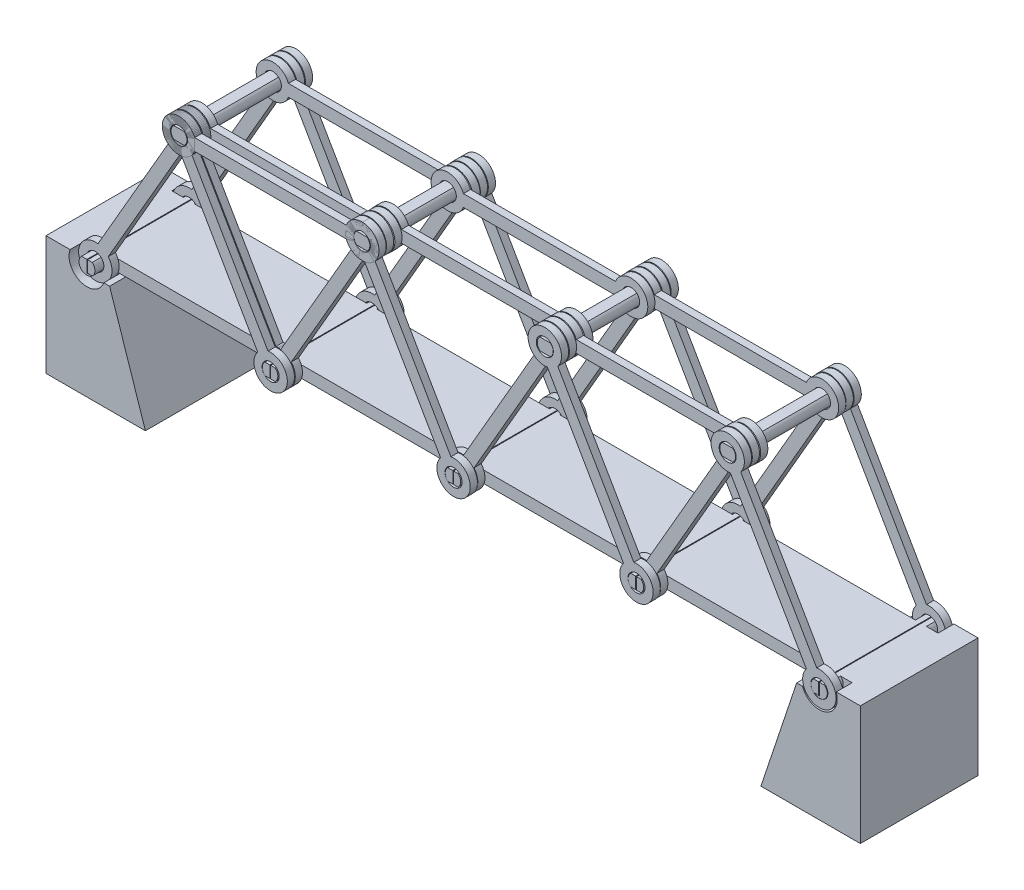
from build123d import *

# Parameters (mm, degrees)
BOSS_EXTRUDE1_DEPTH   = 14.8
BOSS_EXTRUDE1_2_DEPTH = 14.8
SKETCH2_W             = 184.2
SKETCH2_H             = 3
CUT_EXTRUDE1_DEPTH    = 210.091367588
SKETCH3_W             = 45.8
SKETCH3_H             = 2.95
BOSS_EXTRUDE2_DEPTH   = 10.8
BOSS_EXTRUDE3_START   = -14.8
BOSS_EXTRUDE3_DEPTH   = 29.6
SKETCH6_R             = 4.5
SKETCH6_R_2           = 2
CUT_EXTRUDE2_DEPTH    = 4
LPATTERN1_COUNT       = 4
LPATTERN1_PITCH       = 46
BOSS_EXTRUDE4_START   = 0.1
SKETCH7_R             = 2.15
BOSS_EXTRUDE4_DEPTH   = 1.8
CIRPATTERN1_COUNT     = 2
CIRPATTERN1_ANGLE     = 60
LPATTERN2_COUNT       = 2
LPATTERN2_PITCH       = 2
LPATTERN3_START       = 8.9
LPATTERN3_OUTLINE_R   = 2.15
LPATTERN3_DEPTH       = 1.8
LPATTERN3_START_2     = 12.9
LPATTERN3_2_OUTLINE_R = 2.15
LPATTERN3_2_DEPTH     = 1.8
LPATTERN4_COUNT       = 4
LPATTERN4_PITCH       = 46
LPATTERN5_START       = 6.9
LPATTERN5_OUTLINE_R   = 2.15
LPATTERN5_DEPTH       = 1.8
LPATTERN5_START_2     = 8.9
LPATTERN5_2_OUTLINE_R = 2.15
LPATTERN5_2_DEPTH     = 1.8
MIRROR2_START         = -14.7
MIRROR2_OUTLINE_R     = 2.15
MIRROR2_DEPTH         = 1.8
MIRROR2_START_2       = -12.7
MIRROR2_2_OUTLINE_R   = 2.15
MIRROR2_2_DEPTH       = 1.8
MIRROR2_START_3       = -10.7
MIRROR2_3_OUTLINE_R   = 2.15
MIRROR2_3_DEPTH       = 1.8
MIRROR2_START_4       = -8.7
MIRROR2_4_OUTLINE_R   = 2.15
MIRROR2_4_DEPTH       = 1.8
BOSS_EXTRUDE5_DEPTH   = 29.4
BOSS_EXTRUDE5_2_DEPTH = 29.4
BOSS_EXTRUDE5_3_DEPTH = 29.4
BOSS_EXTRUDE5_4_DEPTH = 29.4


# Read off the part's stored shape, not the designer's step: Boss-Extrude3, LPattern3, LPattern5, Mirror2
with BuildPart() as part:
    # Sketch1 → Boss-Extrude1 (new, symmetric)
    with BuildSketch(Plane.XY):
        Polygon((0, 0), (0, 30), (15, 30), (25, 0), align=None)
    extrude(amount=BOSS_EXTRUDE1_DEPTH, both=True)


with BuildPart() as body_2:
    # Sketch1 → Boss-Extrude1 2 (new, symmetric)
    with BuildSketch(Plane.XY):
        Polygon((179.8, 0), (204.8, 0), (204.8, 30), (189.8, 30), align=None)
    extrude(amount=BOSS_EXTRUDE1_2_DEPTH, both=True)


with BuildPart() as cut_extrude1_tool:
    # Sketch2 → Cut-Extrude1 (new, through all)
    with BuildSketch(Plane.XY.offset(14.8)):
        with Locations((102.4, 28.5)):
            Rectangle(SKETCH2_W, SKETCH2_H)
    extrude(amount=-CUT_EXTRUDE1_DEPTH)


with BuildPart() as part_1:
    add(part.part)

    # Cut-Extrude1: cut by cut_extrude1_tool
    add(cut_extrude1_tool.part, mode=Mode.SUBTRACT)


with BuildPart() as body_2_1:
    add(body_2.part)

    # Cut-Extrude1: cut by cut_extrude1_tool
    add(cut_extrude1_tool.part, mode=Mode.SUBTRACT)


with BuildPart() as body_3:
    # Sketch3 → Boss-Extrude2 (new, symmetric)
    with BuildSketch(Plane.XY):
        with Locations((33.4, 28.525)):
            Rectangle(SKETCH3_W, SKETCH3_H)
    extrude(amount=BOSS_EXTRUDE2_DEPTH, both=True)

    # Boss-Extrude3 outline → Boss-Extrude3 (add)
    with BuildSketch(Plane.XY.offset(BOSS_EXTRUDE3_START)):
        with BuildLine():
            Line((10.5, 30), (10.5, 27.05))
            Line((10.5, 27.05), (11.650694266, 27.05))
            ThreePointArc((11.650694266, 27.05), (12.3, 28.525), (11.650694266, 30))
            Line((11.650694266, 30), (10.5, 30))
        make_face()
        with BuildLine():
            ThreePointArc((55.049305734, 30), (54.4, 28.525), (55.049305734, 27.05))
            Line((55.049305734, 27.05), (56.3, 27.05))
            Line((56.3, 27.05), (56.3, 30))
            Line((56.3, 30), (55.049305734, 30))
        make_face()
    extrude(amount=BOSS_EXTRUDE3_DEPTH)


with BuildPart() as cut_extrude2_tool:
    # Sketch6 → Cut-Extrude2 (new body)
    # profile 1 of 2: a face of its own
    with BuildSketch(Plane.XY.offset(14.8)):
        with Locations((10.3, 28.525)):
            Circle(SKETCH6_R)
        with Locations((10.3, 28.525)):
            Circle(SKETCH6_R_2, mode=Mode.SUBTRACT)
    # profile 2 of 2: a face of its own
    with BuildSketch(Plane.XY.offset(14.8)):
        with Locations((194.5, 28.5)):
            Circle(SKETCH6_R)
        with Locations((194.5, 28.5)):
            Circle(SKETCH6_R_2, mode=Mode.SUBTRACT)
    cut_extrude2 = extrude(amount=-CUT_EXTRUDE2_DEPTH)


with BuildPart() as part_2:
    add(part_1.part)

    # Cut-Extrude2: cut by cut_extrude2_tool
    add(cut_extrude2_tool.part, mode=Mode.SUBTRACT)


with BuildPart() as body_2_2:
    add(body_2_1.part)

    # Cut-Extrude2: cut by cut_extrude2_tool
    add(cut_extrude2_tool.part, mode=Mode.SUBTRACT)


with BuildPart() as mirror1_tool:
    # Mirror1: Cut-Extrude2 across plane
    add(cut_extrude2.mirror(Plane.XY))


with BuildPart() as part_3:
    add(part_2.part)

    # Mirror1: cut by mirror1_tool
    add(mirror1_tool.part, mode=Mode.SUBTRACT)


with BuildPart() as body_2_3:
    add(body_2_2.part)

    # Mirror1: cut by mirror1_tool
    add(mirror1_tool.part, mode=Mode.SUBTRACT)


with BuildPart() as lpattern1_1:
    # LPattern1: pattern copy
    add(body_3.part.moved(Location(Vector(1, 0, 0) * (1 * LPATTERN1_PITCH))))


with BuildPart() as lpattern1_2:
    # LPattern1: pattern copy
    add(body_3.part.moved(Location(Vector(1, 0, 0) * (2 * LPATTERN1_PITCH))))


with BuildPart() as lpattern1_3:
    # LPattern1: pattern copy
    add(body_3.part.moved(Location(Vector(1, 0, 0) * (3 * LPATTERN1_PITCH))))


with BuildPart() as body_7:
    # Sketch7 → Boss-Extrude4 (new body)
    # profile 1 of 6: a face of its own
    with BuildSketch(Plane.XY.offset(10.8).offset(BOSS_EXTRUDE4_START)):
        with BuildLine():
            Line((13.56054263, 31.172425496), (13.033403127, 30.259393094))
            Line((13.033403127, 30.259393094), (10.435326916, 31.759393094))
            Line((10.435326916, 31.759393094), (10.962466419, 32.672425496))
            ThreePointArc((10.962466419, 32.672425496), (6.669394917, 26.413435004), (14.232476955, 27.05))
            Line((14.232476955, 27.05), (11.864249021, 27.05))
            ThreePointArc((11.864249021, 27.05), (8.15, 28.525), (11.864249021, 30))
            Line((11.864249021, 30), (14.232476955, 30))
            ThreePointArc((14.232476955, 30), (13.94397147, 30.613413734), (13.56054263, 31.172425496))
        make_face()
    # profile 2 of 6: a face of its own
    with BuildSketch(Plane.XY.offset(10.8).offset(BOSS_EXTRUDE4_START)):
        with BuildLine():
            Line((10.435326916, 31.759393094), (13.033403127, 30.259393094))
            Line((13.033403127, 30.259393094), (13.56054263, 31.172425496))
            ThreePointArc((13.56054263, 31.172425496), (12.4, 32.162306696), (10.962466419, 32.672425496))
            Line((10.962466419, 32.672425496), (10.435326916, 31.759393094))
        make_face()
    # profile 3 of 6: a face of its own
    with BuildSketch(Plane.XY.offset(10.8).offset(BOSS_EXTRUDE4_START)):
        with BuildLine():
            ThreePointArc((14.5, 28.525), (14.432578082, 29.274532117), (14.232476955, 30))
            Line((14.232476955, 30), (11.864249021, 30))
            ThreePointArc((11.864249021, 30), (12.298203618, 29.318525237), (12.45, 28.525))
            ThreePointArc((12.45, 28.525), (12.298203618, 27.731474763), (11.864249021, 27.05))
            Line((11.864249021, 27.05), (14.232476955, 27.05))
            ThreePointArc((14.232476955, 27.05), (14.432578082, 27.775467883), (14.5, 28.525))
        make_face()
    # profile 4 of 6: a face of its own
    with BuildSketch(Plane.XY.offset(10.8).offset(BOSS_EXTRUDE4_START)):
        with BuildLine():
            ThreePointArc((10.962466419, 32.672425496), (12.4, 32.162306696), (13.56054263, 31.172425496))
            Line((13.56054263, 31.172425496), (32.687533581, 64.301345619))
            ThreePointArc((32.687533581, 64.301345619), (31.25, 64.811464419), (30.08945737, 65.801345619))
            Line((30.08945737, 65.801345619), (10.962466419, 32.672425496))
        make_face()
    # profile 5 of 6: a face of its own
    with BuildSketch(Plane.XY.offset(10.8).offset(BOSS_EXTRUDE4_START)):
        with BuildLine():
            Line((33.214673084, 65.214378021), (32.687533581, 64.301345619))
            ThreePointArc((32.687533581, 64.301345619), (36.075586271, 65.253277494), (37.55, 68.448771114))
            ThreePointArc((37.55, 68.448771114), (31.945414482, 72.406944876), (30.08945737, 65.801345619))
            Line((30.08945737, 65.801345619), (30.616596873, 66.714378021))
            Line((30.616596873, 66.714378021), (33.214673084, 65.214378021))
        make_face()
        with Locations((33.35, 68.448771114)):
            Circle(SKETCH7_R, mode=Mode.SUBTRACT)
    # profile 6 of 6: a face of its own
    with BuildSketch(Plane.XY.offset(10.8).offset(BOSS_EXTRUDE4_START)):
        with BuildLine():
            ThreePointArc((30.08945737, 65.801345619), (31.25, 64.811464419), (32.687533581, 64.301345619))
            Line((32.687533581, 64.301345619), (33.214673084, 65.214378021))
            Line((33.214673084, 65.214378021), (30.616596873, 66.714378021))
            Line((30.616596873, 66.714378021), (30.08945737, 65.801345619))
        make_face()
    extrude(amount=BOSS_EXTRUDE4_DEPTH)


with BuildPart() as cirpattern1_1:
    # CirPattern1: pattern copy
    add(body_7.part.rotate(Axis((33.35, 68.448771114, 0), (0, 0, 1)), 1 * CIRPATTERN1_ANGLE / (CIRPATTERN1_COUNT - 1)))


with BuildPart() as lpattern2_1:
    # LPattern2: pattern copy
    add(cirpattern1_1.part.moved(Location(Vector(0, 0, 1) * (1 * LPATTERN2_PITCH))))


with BuildPart() as body_10:
    # LPattern3 outline → LPattern3 (new body)
    with BuildSketch(Plane.XY.offset(LPATTERN3_START)):
        with BuildLine():
            ThreePointArc((75.526990951, 66.948771114), (83.65, 68.448771114), (75.526990951, 69.948771114))
            Line((75.526990951, 69.948771114), (37.273009049, 69.948771114))
            ThreePointArc((37.273009049, 69.948771114), (29.15, 68.448771114), (37.273009049, 66.948771114))
            Line((37.273009049, 66.948771114), (75.526990951, 66.948771114))
        make_face()
        with Locations((33.35, 68.448771114)):
            Circle(LPATTERN3_OUTLINE_R, mode=Mode.SUBTRACT)
        with Locations((79.45, 68.448771114)):
            Circle(LPATTERN3_OUTLINE_R, mode=Mode.SUBTRACT)
    extrude(amount=LPATTERN3_DEPTH)


with BuildPart() as body_11:
    # LPattern3 2 outline → LPattern3 2 (new body)
    with BuildSketch(Plane.XY.offset(LPATTERN3_START_2)):
        with BuildLine():
            ThreePointArc((75.526990951, 66.948771114), (83.65, 68.448771114), (75.526990951, 69.948771114))
            Line((75.526990951, 69.948771114), (37.273009049, 69.948771114))
            ThreePointArc((37.273009049, 69.948771114), (29.15, 68.448771114), (37.273009049, 66.948771114))
            Line((37.273009049, 66.948771114), (75.526990951, 66.948771114))
        make_face()
        with Locations((33.35, 68.448771114)):
            Circle(LPATTERN3_2_OUTLINE_R, mode=Mode.SUBTRACT)
        with Locations((79.45, 68.448771114)):
            Circle(LPATTERN3_2_OUTLINE_R, mode=Mode.SUBTRACT)
    extrude(amount=LPATTERN3_2_DEPTH)


with BuildPart() as lpattern4_1:
    # LPattern4: pattern copy
    add(lpattern2_1.part.moved(Location(Vector(1, 0, 0) * (1 * LPATTERN4_PITCH))))


with BuildPart() as lpattern4_2:
    # LPattern4: pattern copy
    add(lpattern2_1.part.moved(Location(Vector(1, 0, 0) * (2 * LPATTERN4_PITCH))))


with BuildPart() as lpattern4_3:
    # LPattern4: pattern copy
    add(lpattern2_1.part.moved(Location(Vector(1, 0, 0) * (3 * LPATTERN4_PITCH))))


with BuildPart() as lpattern4_4:
    # LPattern4: pattern copy
    add(body_7.part.moved(Location(Vector(1, 0, 0) * (1 * LPATTERN4_PITCH))))


with BuildPart() as lpattern4_5:
    # LPattern4: pattern copy
    add(body_7.part.moved(Location(Vector(1, 0, 0) * (2 * LPATTERN4_PITCH))))


with BuildPart() as lpattern4_6:
    # LPattern4: pattern copy
    add(body_7.part.moved(Location(Vector(1, 0, 0) * (3 * LPATTERN4_PITCH))))


with BuildPart() as body_18:
    # LPattern5 outline → LPattern5 (new body)
    with BuildSketch(Plane.XY.offset(LPATTERN5_START)):
        with BuildLine():
            Line((121.526990951, 69.948771114), (83.273009049, 69.948771114))
            ThreePointArc((83.273009049, 69.948771114), (75.15, 68.448771114), (83.273009049, 66.948771114))
            Line((83.273009049, 66.948771114), (121.526990951, 66.948771114))
            ThreePointArc((121.526990951, 66.948771114), (129.65, 68.448771114), (121.526990951, 69.948771114))
        make_face()
        with Locations((125.45, 68.448771114)):
            Circle(LPATTERN5_OUTLINE_R, mode=Mode.SUBTRACT)
        with Locations((79.35, 68.448771114)):
            Circle(LPATTERN5_OUTLINE_R, mode=Mode.SUBTRACT)
    extrude(amount=LPATTERN5_DEPTH)


with BuildPart() as body_19:
    # LPattern5 2 outline → LPattern5 2 (new body)
    with BuildSketch(Plane.XY.offset(LPATTERN5_START_2)):
        with BuildLine():
            ThreePointArc((167.526990951, 66.948771114), (175.65, 68.448771114), (167.526990951, 69.948771114))
            Line((167.526990951, 69.948771114), (129.273009049, 69.948771114))
            ThreePointArc((129.273009049, 69.948771114), (121.15, 68.448771114), (129.273009049, 66.948771114))
            Line((129.273009049, 66.948771114), (167.526990951, 66.948771114))
        make_face()
        with Locations((171.45, 68.448771114)):
            Circle(LPATTERN5_2_OUTLINE_R, mode=Mode.SUBTRACT)
        with Locations((125.35, 68.448771114)):
            Circle(LPATTERN5_2_OUTLINE_R, mode=Mode.SUBTRACT)
    extrude(amount=LPATTERN5_2_DEPTH)


with BuildPart() as body_20:
    # Mirror2 outline → Mirror2 (new body)
    # profile 1 of 4: a face of its own
    with BuildSketch(Plane.XY.offset(MIRROR2_START)):
        with BuildLine():
            ThreePointArc((191.13945737, 31.172425496), (196.500000001, 24.887693304), (193.737533581, 32.672425496))
            Line((193.737533581, 32.672425496), (174.61054263, 65.801345619))
            ThreePointArc((174.61054263, 65.801345619), (169.25, 72.08607781), (172.012466419, 64.301345619))
            Line((172.012466419, 64.301345619), (191.13945737, 31.172425496))
        make_face()
        with Locations((194.4, 28.525)):
            Circle(MIRROR2_OUTLINE_R, mode=Mode.SUBTRACT)
        with Locations((171.35, 68.448771114)):
            Circle(MIRROR2_OUTLINE_R, mode=Mode.SUBTRACT)
    # profile 2 of 4: a face of its own
    with BuildSketch(Plane.XY.offset(MIRROR2_START)):
        with BuildLine():
            Line((147.737533581, 32.672425496), (128.61054263, 65.801345619))
            ThreePointArc((128.61054263, 65.801345619), (123.25, 72.08607781), (126.012466419, 64.301345619))
            Line((126.012466419, 64.301345619), (145.13945737, 31.172425496))
            ThreePointArc((145.13945737, 31.172425496), (150.500000001, 24.887693304), (147.737533581, 32.672425496))
        make_face()
        with Locations((148.4, 28.525)):
            Circle(MIRROR2_OUTLINE_R, mode=Mode.SUBTRACT)
        with Locations((125.35, 68.448771114)):
            Circle(MIRROR2_OUTLINE_R, mode=Mode.SUBTRACT)
    # profile 3 of 4: a face of its own
    with BuildSketch(Plane.XY.offset(MIRROR2_START)):
        with BuildLine():
            Line((80.012466419, 64.301345619), (99.13945737, 31.172425496))
            ThreePointArc((99.13945737, 31.172425496), (104.500000001, 24.887693304), (101.737533581, 32.672425496))
            Line((101.737533581, 32.672425496), (82.61054263, 65.801345619))
            ThreePointArc((82.61054263, 65.801345619), (77.25, 72.08607781), (80.012466419, 64.301345619))
        make_face()
        with Locations((79.35, 68.448771114)):
            Circle(MIRROR2_OUTLINE_R, mode=Mode.SUBTRACT)
        with Locations((102.4, 28.525)):
            Circle(MIRROR2_OUTLINE_R, mode=Mode.SUBTRACT)
    # profile 4 of 4: a face of its own
    with BuildSketch(Plane.XY.offset(MIRROR2_START)):
        with BuildLine():
            ThreePointArc((37.273009049, 66.948771114), (37.55, 68.448771114), (37.273009049, 69.948771114))
            ThreePointArc((37.273009049, 69.948771114), (29.712693304, 70.548771114), (34.012466419, 64.301345618))
            Line((34.012466419, 64.301345618), (53.13945737, 31.172425496))
            ThreePointArc((53.13945737, 31.172425496), (58.500000001, 24.887693304), (55.737533581, 32.672425496))
            Line((55.737533581, 32.672425496), (36.61054263, 65.801345619))
            ThreePointArc((36.61054263, 65.801345619), (36.987306696, 66.348771114), (37.273009049, 66.948771114))
        make_face()
        with Locations((33.35, 68.448771114)):
            Circle(MIRROR2_OUTLINE_R, mode=Mode.SUBTRACT)
        with Locations((56.4, 28.525)):
            Circle(MIRROR2_OUTLINE_R, mode=Mode.SUBTRACT)
    extrude(amount=MIRROR2_DEPTH)


with BuildPart() as body_21:
    # Mirror2 2 outline → Mirror2 2 (new body)
    # profile 1 of 4: a face of its own
    with BuildSketch(Plane.XY.offset(MIRROR2_START_2)):
        with BuildLine():
            ThreePointArc((172.012466419, 64.301345619), (173.45, 64.811464419), (174.61054263, 65.801345619))
            ThreePointArc((174.61054263, 65.801345619), (171.35, 72.648771114), (168.08945737, 65.801345619))
            Line((168.08945737, 65.801345619), (148.962466419, 32.672425496))
            ThreePointArc((148.962466419, 32.672425496), (146.199999999, 24.887693304), (151.56054263, 31.172425496))
            Line((151.56054263, 31.172425496), (170.687533581, 64.301345619))
            ThreePointArc((170.687533581, 64.301345619), (171.35, 64.248771115), (172.012466419, 64.301345619))
        make_face()
        with Locations((171.35, 68.448771114)):
            Circle(MIRROR2_2_OUTLINE_R, mode=Mode.SUBTRACT)
        with Locations((148.3, 28.525)):
            Circle(MIRROR2_2_OUTLINE_R, mode=Mode.SUBTRACT)
    # profile 2 of 4: a face of its own
    with BuildSketch(Plane.XY.offset(MIRROR2_START_2)):
        with BuildLine():
            Line((122.08945737, 65.801345619), (102.962466419, 32.672425496))
            ThreePointArc((102.962466419, 32.672425496), (100.199999999, 24.887693304), (105.56054263, 31.172425496))
            Line((105.56054263, 31.172425496), (124.687533581, 64.301345619))
            ThreePointArc((124.687533581, 64.301345619), (125.35, 64.248771115), (126.012466419, 64.301345619))
            ThreePointArc((126.012466419, 64.301345619), (127.45, 64.811464418), (128.61054263, 65.801345619))
            ThreePointArc((128.61054263, 65.801345619), (125.35, 72.648771114), (122.08945737, 65.801345619))
        make_face()
        with Locations((125.35, 68.448771114)):
            Circle(MIRROR2_2_OUTLINE_R, mode=Mode.SUBTRACT)
        with Locations((102.3, 28.525)):
            Circle(MIRROR2_2_OUTLINE_R, mode=Mode.SUBTRACT)
    # profile 3 of 4: a face of its own
    with BuildSketch(Plane.XY.offset(MIRROR2_START_2)):
        with BuildLine():
            Line((76.08945737, 65.801345619), (56.962466419, 32.672425496))
            ThreePointArc((56.962466419, 32.672425496), (54.199999999, 24.887693304), (59.56054263, 31.172425496))
            Line((59.56054263, 31.172425496), (78.687533581, 64.301345619))
            ThreePointArc((78.687533581, 64.301345619), (79.35, 64.248771115), (80.012466419, 64.301345619))
            ThreePointArc((80.012466419, 64.301345619), (81.45, 64.811464418), (82.61054263, 65.801345619))
            ThreePointArc((82.61054263, 65.801345619), (79.35, 72.648771114), (76.08945737, 65.801345619))
        make_face()
        with Locations((79.35, 68.448771114)):
            Circle(MIRROR2_2_OUTLINE_R, mode=Mode.SUBTRACT)
        with Locations((56.3, 28.525)):
            Circle(MIRROR2_2_OUTLINE_R, mode=Mode.SUBTRACT)
    # profile 4 of 4: a face of its own
    with BuildSketch(Plane.XY.offset(MIRROR2_START_2)):
        with BuildLine():
            ThreePointArc((37.273009049, 66.948771114), (37.55, 68.448771114), (37.273009049, 69.948771114))
            ThreePointArc((37.273009049, 69.948771114), (31.25, 72.08607781), (30.089457369, 65.801345619))
            Line((30.089457369, 65.801345619), (10.962466419, 32.672425496))
            ThreePointArc((10.962466419, 32.672425496), (8.199999999, 24.887693304), (13.56054263, 31.172425496))
            Line((13.56054263, 31.172425496), (32.687533581, 64.301345618))
            ThreePointArc((32.687533581, 64.301345618), (35.45, 64.811464418), (37.273009049, 66.948771114))
        make_face()
        with Locations((33.35, 68.448771114)):
            Circle(MIRROR2_2_OUTLINE_R, mode=Mode.SUBTRACT)
        with Locations((10.3, 28.525)):
            Circle(MIRROR2_2_OUTLINE_R, mode=Mode.SUBTRACT)
    extrude(amount=MIRROR2_2_DEPTH)


with BuildPart() as body_22:
    # Mirror2 3 outline → Mirror2 3 (new body)
    # profile 1 of 2: a face of its own
    with BuildSketch(Plane.XY.offset(MIRROR2_START_3)):
        with BuildLine():
            Line((167.526990951, 69.948771114), (129.273009049, 69.948771114))
            ThreePointArc((129.273009049, 69.948771114), (121.712693304, 70.548771114), (126.012466419, 64.301345619))
            ThreePointArc((126.012466419, 64.301345619), (127.45, 64.811464418), (128.61054263, 65.801345619))
            ThreePointArc((128.61054263, 65.801345619), (128.987306695, 66.348771115), (129.273009049, 66.948771114))
            Line((129.273009049, 66.948771114), (167.526990951, 66.948771114))
            ThreePointArc((167.526990951, 66.948771114), (175.65, 68.448771114), (167.526990951, 69.948771114))
        make_face()
        with Locations((171.45, 68.448771114)):
            Circle(MIRROR2_3_OUTLINE_R, mode=Mode.SUBTRACT)
        with Locations((125.35, 68.448771114)):
            Circle(MIRROR2_3_OUTLINE_R, mode=Mode.SUBTRACT)
    # profile 2 of 2: a face of its own
    with BuildSketch(Plane.XY.offset(MIRROR2_START_3)):
        with BuildLine():
            Line((75.526990951, 69.948771114), (37.273009049, 69.948771114))
            ThreePointArc((37.273009049, 69.948771114), (29.15, 68.448771114), (37.273009049, 66.948771114))
            Line((37.273009049, 66.948771114), (75.526990951, 66.948771114))
            ThreePointArc((75.526990951, 66.948771114), (83.65, 68.448771114), (75.526990951, 69.948771114))
        make_face()
        with Locations((79.45, 68.448771114)):
            Circle(MIRROR2_3_OUTLINE_R, mode=Mode.SUBTRACT)
        with Locations((33.35, 68.448771114)):
            Circle(MIRROR2_3_OUTLINE_R, mode=Mode.SUBTRACT)
    extrude(amount=MIRROR2_3_DEPTH)


with BuildPart() as body_23:
    # Mirror2 4 outline → Mirror2 4 (new body)
    with BuildSketch(Plane.XY.offset(MIRROR2_START_4)):
        with BuildLine():
            Line((121.526990951, 69.948771114), (83.273009049, 69.948771114))
            ThreePointArc((83.273009049, 69.948771114), (75.712693304, 70.548771114), (80.012466419, 64.301345619))
            ThreePointArc((80.012466419, 64.301345619), (81.45, 64.811464418), (82.61054263, 65.801345619))
            ThreePointArc((82.61054263, 65.801345619), (82.987306695, 66.348771115), (83.273009049, 66.948771114))
            Line((83.273009049, 66.948771114), (121.526990951, 66.948771114))
            ThreePointArc((121.526990951, 66.948771114), (129.65, 68.448771114), (121.526990951, 69.948771114))
        make_face()
        with Locations((125.45, 68.448771114)):
            Circle(MIRROR2_4_OUTLINE_R, mode=Mode.SUBTRACT)
        with Locations((79.35, 68.448771114)):
            Circle(MIRROR2_4_OUTLINE_R, mode=Mode.SUBTRACT)
    extrude(amount=MIRROR2_4_DEPTH)


with BuildPart() as body_24:
    # Sketch8 → Boss-Extrude5 (new body)
    with BuildSketch(Plane.XY.offset(14.7)):
        with BuildLine():
            Line((32.027124344, 66.948771114), (34.672875656, 66.948771114))
            ThreePointArc((34.672875656, 66.948771114), (35.172875656, 67.625895459), (35.35, 68.448771114))
            ThreePointArc((35.35, 68.448771114), (35.172875656, 69.27164677), (34.672875656, 69.948771114))
            Line((34.672875656, 69.948771114), (32.027124344, 69.948771114))
            ThreePointArc((32.027124344, 69.948771114), (31.35, 68.448771114), (32.027124344, 66.948771114))
        make_face()
    extrude(amount=-BOSS_EXTRUDE5_DEPTH)


with BuildPart() as body_25:
    # Sketch8 → Boss-Extrude5 2 (new body)
    with BuildSketch(Plane.XY.offset(14.7)):
        with BuildLine():
            Line((78.027124344, 66.948771114), (80.672875656, 66.948771114))
            ThreePointArc((80.672875656, 66.948771114), (81.172875656, 67.625895459), (81.35, 68.448771114))
            ThreePointArc((81.35, 68.448771114), (81.172875656, 69.27164677), (80.672875656, 69.948771114))
            Line((80.672875656, 69.948771114), (78.027124344, 69.948771114))
            ThreePointArc((78.027124344, 69.948771114), (77.35, 68.448771114), (78.027124344, 66.948771114))
        make_face()
    extrude(amount=-BOSS_EXTRUDE5_2_DEPTH)


with BuildPart() as body_26:
    # Sketch8 → Boss-Extrude5 3 (new body)
    with BuildSketch(Plane.XY.offset(14.7)):
        with BuildLine():
            Line((124.127124344, 66.948771114), (126.772875656, 66.948771114))
            ThreePointArc((126.772875656, 66.948771114), (127.272875656, 67.625895459), (127.45, 68.448771114))
            ThreePointArc((127.45, 68.448771114), (127.272875656, 69.27164677), (126.772875656, 69.948771114))
            Line((126.772875656, 69.948771114), (124.127124344, 69.948771114))
            ThreePointArc((124.127124344, 69.948771114), (123.45, 68.448771114), (124.127124344, 66.948771114))
        make_face()
    extrude(amount=-BOSS_EXTRUDE5_3_DEPTH)


with BuildPart() as body_27:
    # Sketch8 → Boss-Extrude5 4 (new body)
    with BuildSketch(Plane.XY.offset(14.7)):
        with BuildLine():
            Line((170.027124344, 66.948771114), (172.672875656, 66.948771114))
            ThreePointArc((172.672875656, 66.948771114), (173.172875656, 67.625895459), (173.35, 68.448771114))
            ThreePointArc((173.35, 68.448771114), (173.172875656, 69.27164677), (172.672875656, 69.948771114))
            Line((172.672875656, 69.948771114), (170.027124344, 69.948771114))
            ThreePointArc((170.027124344, 69.948771114), (169.35, 68.448771114), (170.027124344, 66.948771114))
        make_face()
    extrude(amount=-BOSS_EXTRUDE5_4_DEPTH)


solid = Compound([body_3.part, part_3.part, body_2_3.part, lpattern1_1.part, lpattern1_2.part, lpattern1_3.part, body_7.part, cirpattern1_1.part, lpattern2_1.part, body_10.part, body_11.part, lpattern4_1.part, lpattern4_2.part, lpattern4_3.part, lpattern4_4.part, lpattern4_5.part, lpattern4_6.part, body_18.part, body_19.part, body_20.part, body_21.part, body_22.part, body_23.part, body_24.part, body_25.part, body_26.part, body_27.part])
